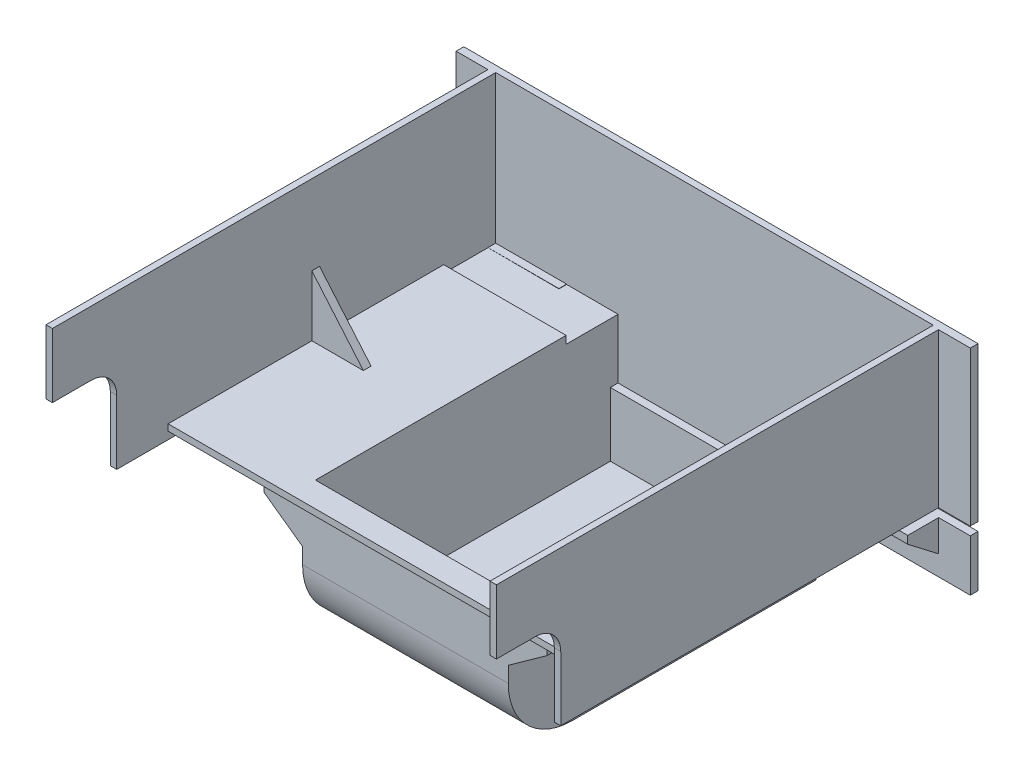
from build123d import *

# Parameters (mm, degrees)
EXTRUDE_1_DEPTH          = 3
EXTRUDE_2_DEPTH          = 121.210911
SKETCH_3_W               = 47.605950515
SKETCH_3_H               = 3
CUT_EXTRUDE_1_DEPTH      = 99
SKETCH_5_W               = 185.441878516
SKETCH_5_H               = 108.742952173
CUT_EXTRUDE_2_DEPTH      = 1.5
SKETCH_6_W               = 175.21190103
SKETCH_6_H               = 36.65
EXTRUDE_3_DEPTH          = 7.2
SHELL_START              = 5.5
SHELL_1_DEPTH            = 114.710911355
SHELL_START_2            = 2.5
SHELL_1_2_OUTLINE_W      = 170.21190103
SHELL_1_2_OUTLINE_H      = 34.15
SHELL_1_2_DEPTH          = 124.910911355
SHELL_1_3_DEPTH          = 20.210911355
SHELL_1_4_DEPTH          = 17.210911355
SKETCH_7_W               = 170.21190103
SKETCH_7_H               = 34.15
CUT_EXTRUDE_3_DEPTH      = 7.2
SKETCH_8_W               = 2.5
SKETCH_8_H               = 36.65
EXTRUDE_4_DEPTH          = 45
CUT_EXTRUDE_4_DEPTH      = 261.975558395
SKETCH_10_W              = 2.5
SKETCH_10_H              = 2.880985124
EXTRUDE_5_DEPTH          = 124.689092
SKETCH_11_W              = 36.523943303
SKETCH_11_H              = 3
EXTRUDE_6_DEPTH          = 15
SKETCH_12_W              = 36.475357481
SKETCH_12_H              = 3.054288943
EXTRUDE_7_DEPTH          = 15
FILLET_1_R               = 25
SKETCH_13_W              = 43.927566906
SKETCH_13_H              = 9.945864205
EXTRUDE_8_DEPTH          = 8
CUT_EXTRUDE_5_DEPTH      = 219.603325421
SKETCH_15_W              = 43.927566906
SKETCH_15_H              = 9.945864205
EXTRUDE_9_DEPTH          = 2
SKETCH_17_W              = 27.673413216
SKETCH_17_H              = 3
EXTRUDE_10_DEPTH         = 12
RIB_1_REACH              = 263.024
SKETCH_18_WALL_W         = 539.179228978
SKETCH_18_WALL_H         = 3
MIRROR_5_COPY_1_REACH    = 263.024
MIRROR_5_COPY_1_SKETCH_W = 539.179228978
MIRROR_5_COPY_1_SKETCH_H = 3
RIB_2_REACH              = 175.005
SKETCH_19_WALL_W         = 366.464948776
SKETCH_19_WALL_H         = 3
MIRROR_7_COPY_1_REACH    = 175.005
MIRROR_7_COPY_1_SKETCH_W = 366.464948776
MIRROR_7_COPY_1_SKETCH_H = 3
RIB_3_REACH              = 153.018
SKETCH_20_WALL_W         = 334.972416452
SKETCH_20_WALL_H         = 3
EXTRUDE_11_DEPTH         = 20.47
CUT_EXTRUDE_6_DEPTH      = 264.412642976


# Read off the part's stored shape, not the designer's step: 抽壳1
with BuildPart() as part:
    # 草图1 → 凸台-拉伸1 (new body)
    with BuildSketch(Plane.XY):
        Polygon((-100, 0), (-60, 0), (-60, -3.3), (-100, -3.3), (-100, -23.3), (100, -23.3), (100, -3.3), (60, -3.3), (60, 0), (100, 0), (100, 39.5), (-100, 39.5), align=None)
    extrude(amount=EXTRUDE_1_DEPTH)

    # 草图2 → 凸台-拉伸2 (add)
    with BuildSketch(Plane.XY.offset(3)):
        Polygon((40, -48.15), (-40, -48.15), (-40, -0.15), (-87.605950515, -0.030985124), (-87.605950515, 39.5), (87.605950515, 39.5), (87.605950515, -0.030985124), (40, -0.15), align=None)
    extrude(amount=EXTRUDE_2_DEPTH)

    # 草图3 → 切除-拉伸1 (cut)
    with BuildSketch(Plane.XY.offset(124.210911355)):
        with Locations((63.802975258, 1.35)):
            Rectangle(SKETCH_3_W, SKETCH_3_H)
        with Locations((-63.802975258, 1.35)):
            Rectangle(SKETCH_3_W, SKETCH_3_H)
    extrude(amount=-CUT_EXTRUDE_1_DEPTH, mode=Mode.SUBTRACT)

    # 草图5 → 切除-拉伸2 (cut)
    with BuildSketch(Plane.XY.offset(124.210911355)):
        with Locations((-1.343781728, 1.77370169)):
            Rectangle(SKETCH_5_W, SKETCH_5_H)
    extrude(amount=-CUT_EXTRUDE_2_DEPTH, mode=Mode.SUBTRACT)

    # 草图6 → 凸台-拉伸3 (add)
    with BuildSketch(Plane.XY.offset(122.710911355)):
        with Locations((0, 21.175)):
            Rectangle(SKETCH_6_W, SKETCH_6_H)
    extrude(amount=EXTRUDE_3_DEPTH)

    # 抽壳1 outline → 抽壳1 (cut)
    with BuildSketch(Plane.XY.offset(SHELL_START)):
        Polygon((-85.105950515, 39.5), (-85.105950515, 5.35), (-37.5, 5.35), (-37.5, -45.65), (37.5, -45.65), (37.5, 5.35), (85.105950515, 5.35), (85.105950515, 39.5), align=None)
    extrude(amount=SHELL_1_DEPTH, mode=Mode.SUBTRACT)

    # Shell 1 2 outline → Shell 1 2 (cut)
    with BuildSketch(Plane.XY.offset(SHELL_START_2)):
        with Locations((0, 22.425)):
            Rectangle(SHELL_1_2_OUTLINE_W, SHELL_1_2_OUTLINE_H)
    extrude(amount=SHELL_1_2_DEPTH, mode=Mode.SUBTRACT)

    # Shell 1 3 outline → Shell 1 3 (cut)
    with BuildSketch(Plane.XY.offset(SHELL_START_2)):
        Polygon((-85.105950515, 5.35), (-85.105950515, 2.5), (-57.5, 2.5), (-57.5, 2.393757812), (-37.5, 2.343757812), (-37.5, -20.8), (37.5, -20.8), (37.5, 2.343757812), (57.5, 2.393757812), (57.5, 2.5), (85.105950515, 2.5), (85.105950515, 5.35), align=None)
    extrude(amount=SHELL_1_3_DEPTH, mode=Mode.SUBTRACT)

    # Shell 1 4 outline → Shell 1 4 (cut)
    with BuildSketch(Plane.XY.offset(SHELL_START)):
        Polygon((-85.105950515, 2.5), (-85.105950515, 2.462772689), (-57.5, 2.393757812), (-57.5, 2.5), align=None)
        Polygon((85.105950515, 2.462772689), (85.105950515, 2.5), (57.5, 2.5), (57.5, 2.393757812), align=None)
    extrude(amount=SHELL_1_4_DEPTH, mode=Mode.SUBTRACT)

    # 草图7 → 切除-拉伸3 (cut)
    with BuildSketch(Plane.XY.offset(129.910911355)):
        with Locations((0, 22.425)):
            Rectangle(SKETCH_7_W, SKETCH_7_H)
    extrude(amount=-CUT_EXTRUDE_3_DEPTH, mode=Mode.SUBTRACT)

    # 草图8 → 凸台-拉伸4 (add)
    with BuildSketch(Plane.XY.offset(129.910911355)):
        with Locations((86.355950515, 21.175)):
            Rectangle(SKETCH_8_W, SKETCH_8_H)
    extrude_4 = extrude(amount=EXTRUDE_4_DEPTH)

    # 镜向1: 凸台-拉伸4 across plane
    add(extrude_4.mirror(Plane(origin=(0, 0, 0), x_dir=(0, 0, 1), z_dir=(1, 0, 0))))

    # 草图9 → 切除-拉伸4 (cut, through all)
    with BuildSketch(Plane(origin=(87.605950515, 0, 0), x_dir=(0, 0, -1), z_dir=(1, 0, 0))):
        with BuildLine():
            ThreePointArc((-153.435169701, 14.152379613), (-157.269646082, 19.530454036), (-163.545332043, 21.590225708))
            Line((-163.545332043, 21.590225708), (-164.318099098, 21.561993734))
            Line((-164.318099098, 21.561993734), (-174.910911355, 21.175))
            Line((-174.910911355, 21.175), (-174.910911355, 2.85))
            Line((-174.910911355, 2.85), (-149.900003415, 2.85))
            Line((-149.900003415, 2.85), (-153.435169701, 14.152379613))
        make_face()
    extrude(amount=-CUT_EXTRUDE_4_DEPTH, mode=Mode.SUBTRACT)

    # 草图10 → 凸台-拉伸5 (add)
    with BuildSketch(Plane.XY.offset(25.210911355)):
        with Locations((86.355950515, 1.409507438)):
            Rectangle(SKETCH_10_W, SKETCH_10_H)
        with Locations((-86.355950515, 1.409507438)):
            Rectangle(SKETCH_10_W, SKETCH_10_H)
    extrude(amount=EXTRUDE_5_DEPTH)

    # 草图11 → 凸台-拉伸6 (add)
    with BuildSketch(Plane(origin=(40, 0, 0), x_dir=(0, 0, -1), z_dir=(1, 0, 0))):
        with Locations((-104.448939704, -4.8)):
            Rectangle(SKETCH_11_W, SKETCH_11_H)
    extrude_6 = extrude(amount=EXTRUDE_6_DEPTH)

    # 镜向2: 凸台-拉伸6 across plane
    add(extrude_6.mirror(Plane(origin=(0, 0, 0), x_dir=(0, 0, 1), z_dir=(1, 0, 0))))

    # 草图12 → 凸台-拉伸7 (add)
    with BuildSketch(Plane(origin=(40, 0, 0), x_dir=(0, 0, -1), z_dir=(1, 0, 0))):
        with Locations((-104.525351124, 1.496159348)):
            Rectangle(SKETCH_12_W, SKETCH_12_H)
    extrude_7 = extrude(amount=EXTRUDE_7_DEPTH)

    # 镜向3: 凸台-拉伸7 across plane
    add(extrude_7.mirror(Plane(origin=(0, 0, 0), x_dir=(0, 0, 1), z_dir=(1, 0, 0))))

    # 圆角1
    fillet_1_edges = [part.edges().sort_by_distance(p)[0] for p in [
        (0, -48.15, 122.710911355),
        (0, -45.65, 120.210911355),
    ]]
    fillet(fillet_1_edges, radius=FILLET_1_R)

    # 草图13 → 凸台-拉伸8 (add)
    with BuildSketch(Plane(origin=(0, 0, 0), x_dir=(-1, 0, 0), z_dir=(0, 0, -1))):
        with Locations((0, 10.69739906)):
            Rectangle(SKETCH_13_W, SKETCH_13_H)
    extrude(amount=EXTRUDE_8_DEPTH)

    # 草图14 → 切除-拉伸5 (cut, through all)
    with BuildSketch(Plane(origin=(21.963783453, 0, 0), x_dir=(0, 0, -1), z_dir=(1, 0, 0))):
        with BuildLine():
            add(Edge.make_bspline(
                [(0, 15.670331162), (4.03969355, 12.74473692), (8, 15.670331162)],
                knots=[0, 0, 0, 1, 1, 1], degree=2))
            Line((8, 15.670331162), (0, 15.670331162))
        make_face()
        with BuildLine():
            add(Edge.make_bspline(
                [(0, 5.724466957), (4.03969355, 8.650061199), (8, 5.724466957)],
                knots=[0, 0, 0, 1, 1, 1], degree=2))
            Line((8, 5.724466957), (0, 5.724466957))
        make_face()
    extrude(amount=-CUT_EXTRUDE_5_DEPTH, mode=Mode.SUBTRACT)

    # 草图15 → 凸台-拉伸9 (add)
    with BuildSketch(Plane(origin=(0, 0, -8), x_dir=(-1, 0, 0), z_dir=(0, 0, -1))):
        with Locations((0, 10.69739906)):
            Rectangle(SKETCH_15_W, SKETCH_15_H)
    extrude(amount=EXTRUDE_9_DEPTH)

    # 草图17 → 凸台-拉伸10 (add)
    with BuildSketch(Plane.XY.offset(3)):
        with Locations((73.836706608, -4.8)):
            Rectangle(SKETCH_17_W, SKETCH_17_H)
        with Locations((-73.836706608, -4.8)):
            Rectangle(SKETCH_17_W, SKETCH_17_H)
    extrude(amount=EXTRUDE_10_DEPTH)

    # 草图18 wall → 筋1 (add, up to next)
    with BuildSketch(Plane(origin=(87.673413216, -10.908430107, 9), x_dir=(0, -0.60913308834, -0.793068017694), z_dir=(0, 0.793068017694, -0.60913308834)), mode=Mode.PRIVATE) as rib_1_sk1:
        with Locations((0, 1.5)):
            Rectangle(SKETCH_18_WALL_W, SKETCH_18_WALL_H)
    rib_1_tool1 = extrude(rib_1_sk1.sketch, amount=RIB_1_REACH, mode=Mode.PRIVATE) - part.part
    rib_1 = rib_1_tool1.solids().sort_by_distance((87.673413216, -10.908430107, 9))[0]
    add(rib_1)

    # 镜向4: 筋1 across plane
    add(rib_1.mirror(Plane(origin=(73.836706608, 0, 0), x_dir=(0, 0, 1), z_dir=(1, 0, 0))))

    # 镜向5: 筋1 across plane
    add(rib_1.mirror(Plane(origin=(0, 0, 0), x_dir=(0, 0, 1), z_dir=(1, 0, 0))))

    # 镜向5 copy 1 sketch → 镜向5 copy 1 (add, up to next)
    with BuildSketch(Plane(origin=(-60, -10.908430107, 9), x_dir=(0, -0.60913308834, -0.793068017694), z_dir=(0, 0.793068017694, -0.60913308834)), mode=Mode.PRIVATE) as mirror_5_copy_1_sk1:
        with Locations((0, 1.5)):
            Rectangle(MIRROR_5_COPY_1_SKETCH_W, MIRROR_5_COPY_1_SKETCH_H)
    mirror_5_copy_1_tool1 = extrude(mirror_5_copy_1_sk1.sketch, amount=MIRROR_5_COPY_1_REACH, mode=Mode.PRIVATE) - part.part
    add(mirror_5_copy_1_tool1.solids().sort_by_distance((-60, -10.908430107, 9))[0])

    # 草图19 wall → 筋2 (add, up to next)
    with BuildSketch(Plane(origin=(47.5, -11.676129128, 122.710911355), x_dir=(-0.812759187769, -0.582599779176, 0), z_dir=(0.582599779176, -0.812759187769, 0)), mode=Mode.PRIVATE) as rib_2_sk1:
        with Locations((0, 1.5)):
            Rectangle(SKETCH_19_WALL_W, SKETCH_19_WALL_H)
    rib_2_tool1 = extrude(rib_2_sk1.sketch, amount=-RIB_2_REACH, mode=Mode.PRIVATE) - part.part
    rib_2 = rib_2_tool1.solids().sort_by_distance((47.5, -11.676129128, 122.710911355))[0]
    add(rib_2)

    # 镜向6: 筋2 across plane
    add(rib_2.mirror(Plane.XY.offset(104.448939704)))

    # 镜向7: 筋2 across plane
    add(rib_2.mirror(Plane(origin=(0, 0, 0), x_dir=(0, 0, 1), z_dir=(1, 0, 0))))

    # 镜向7 copy 1 sketch → 镜向7 copy 1 (add, up to next)
    with BuildSketch(Plane(origin=(-47.5, -11.676129128, 86.186968052), x_dir=(0.812759187769, -0.582599779176, 0), z_dir=(-0.582599779176, -0.812759187769, 0)), mode=Mode.PRIVATE) as mirror_7_copy_1_sk1:
        with Locations((0, 1.5)):
            Rectangle(MIRROR_7_COPY_1_SKETCH_W, MIRROR_7_COPY_1_SKETCH_H)
    mirror_7_copy_1_tool1 = extrude(mirror_7_copy_1_sk1.sketch, amount=-MIRROR_7_COPY_1_REACH, mode=Mode.PRIVATE) - part.part
    add(mirror_7_copy_1_tool1.solids().sort_by_distance((-47.5, -11.676129128, 86.186968052))[0])

    # 草图20 wall → 筋3 (add, up to next)
    with BuildSketch(Plane(origin=(75.091649782, 17.139028744, 72.5), x_dir=(-0.647409171989, -0.762142613967, 0), z_dir=(0.762142613967, -0.647409171989, 0)), mode=Mode.PRIVATE) as rib_3_sk1:
        Rectangle(SKETCH_20_WALL_W, SKETCH_20_WALL_H)
    rib_3_tool1 = extrude(rib_3_sk1.sketch, amount=RIB_3_REACH, mode=Mode.PRIVATE) - part.part
    rib_3 = rib_3_tool1.solids().sort_by_distance((75.091649782, 17.139028744, 72.5))[0]
    add(rib_3)

    # 镜向8: 筋3 across plane
    add(rib_3.mirror(Plane(origin=(0, 0, 0), x_dir=(0, 0, 1), z_dir=(1, 0, 0))))

    # 草图21 → 凸台-拉伸11 (add)
    with BuildSketch(Plane(origin=(0, 39.5, 0), x_dir=(1, 0, 0), z_dir=(0, 1, 0))):
        Polygon((-87.605950515, -174.910911355), (-85.105950515, -174.910911355), (-85.105950515, -2.5), (85.105950515, -2.5), (85.105950515, -174.910911355), (87.605950515, -174.910911355), (87.605950515, -3), (100, -3), (100, 0), (87.605950515, 0), (85.105950515, 0), (-85.105950515, 0), (-87.605950515, 0), (-100, 0), (-100, -3), (-87.605950515, -3), align=None)
    extrude(amount=EXTRUDE_11_DEPTH)

    # 草图22 → 切除-拉伸6 (cut, through all)
    with BuildSketch(Plane(origin=(87.605950515, 0, 0), x_dir=(0, 0, -1), z_dir=(1, 0, 0))):
        with BuildLine():
            Line((-149.900003415, -0.030985124), (-149.900003415, 24.969014876))
            ThreePointArc((-149.900003415, 24.969014876), (-152.828935603, 32.040082688), (-159.900003415, 34.969014876))
            Line((-159.900003415, 34.969014876), (-174.910911355, 34.969014876))
            Line((-174.910911355, 34.969014876), (-174.910911355, -0.030985124))
            Line((-174.910911355, -0.030985124), (-149.900003415, -0.030985124))
        make_face()
    extrude(amount=-CUT_EXTRUDE_6_DEPTH, mode=Mode.SUBTRACT)


solid = part.part
